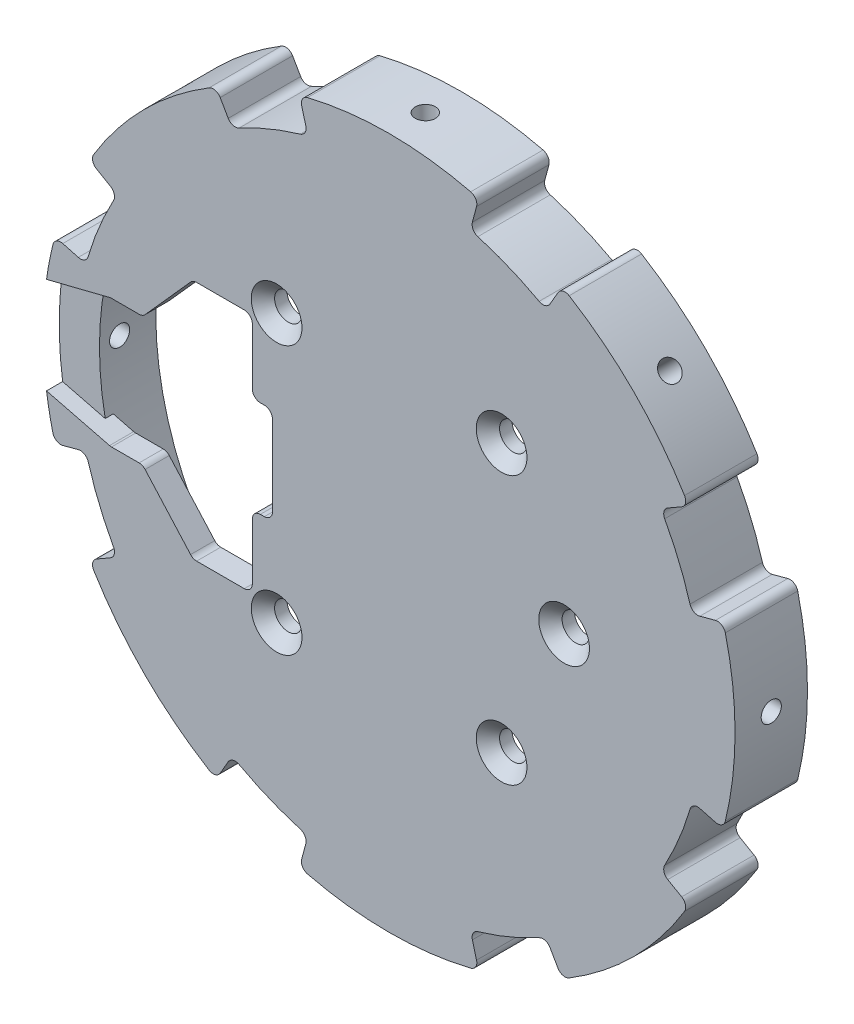
from build123d import *

# Parameters (mm, degrees)
SKETCH_1_R                   = 38
EXTRUDE_1_DEPTH              = 6
EXTRUDE_START                = 3
EXTRUDE_2_DEPTH              = 3
HOLE_WIZARD_M3_1_D           = 3.4
HOLE_WIZARD_M3_1_CSINK_D     = 6.3
HOLE_WIZARD_M3_1_CSINK_ANGLE = 90
M3X0_5_1_D                   = 2.5
M3X0_5_1_ON_FACE_2_D         = 2.5
M3X0_5_1_ON_FACE_3_D         = 2.5
M3X0_5_1_ON_FACE_4_D         = 2.5
M3X0_5_1_ON_FACE_5_D         = 2.5
M3X0_5_1_ON_FACE_6_D         = 2.5
M3X0_5_1_ON_FACE_7_D         = 2.5
M3X0_5_1_ON_FACE_8_D         = 2.5
CUT_EXTRUDE_START            = 3
CUT_EXTRUDE_1_DEPTH          = 3
EXTRUDE_START_2              = 1
EXTRUDE_3_DEPTH              = 1
FILLET_1_R                   = 1
FILLET_2_R                   = 1


with BuildPart() as part:
    # 草图1 → 凸台-拉伸1 (new body)
    with BuildSketch(Plane.XY):
        with BuildLine():
            Line((21.5, 37.239092363), (19.5, 33.774990748))
            ThreePointArc((19.5, 33.774990748), (14.924653862, 36.031301768), (10.093942759, 37.671107225))
            Line((10.093942759, 37.671107225), (11.129218939, 41.53481053))
            ThreePointArc((11.129218939, 41.53481053), (5.612626265, 42.632129039), (0, 43))
            ThreePointArc((0, 43), (-5.612626265, 42.632129039), (-11.129218939, 41.53481053))
            Line((-11.129218939, 41.53481053), (-10.093942759, 37.671107225))
            ThreePointArc((-10.093942759, 37.671107225), (-14.924653862, 36.031301768), (-19.5, 33.774990748))
            Line((-19.5, 33.774990748), (-21.5, 37.239092363))
            ThreePointArc((-21.5, 37.239092363), (-26.176741447, 34.114193633), (-30.405591591, 30.405591591))
            ThreePointArc((-30.405591591, 30.405591591), (-34.114193633, 26.176741447), (-37.239092363, 21.5))
            Line((-37.239092363, 21.5), (-33.774990748, 19.5))
            ThreePointArc((-33.774990748, 19.5), (-36.031301768, 14.924653862), (-37.671107225, 10.093942759))
            Line((-37.671107225, 10.093942759), (-41.53481053, 11.129218939))
            ThreePointArc((-41.53481053, 11.129218939), (-42.632129039, 5.612626265), (-43, 0))
            ThreePointArc((-43, 0), (-42.632129039, -5.612626265), (-41.53481053, -11.129218939))
            Line((-41.53481053, -11.129218939), (-37.671107225, -10.093942759))
            ThreePointArc((-37.671107225, -10.093942759), (-36.031301768, -14.924653862), (-33.774990748, -19.5))
            Line((-33.774990748, -19.5), (-37.239092363, -21.5))
            ThreePointArc((-37.239092363, -21.5), (-34.114193633, -26.176741447), (-30.405591591, -30.405591591))
            ThreePointArc((-30.405591591, -30.405591591), (-26.176741447, -34.114193633), (-21.5, -37.239092363))
            Line((-21.5, -37.239092363), (-19.5, -33.774990748))
            ThreePointArc((-19.5, -33.774990748), (-14.924653862, -36.031301768), (-10.093942759, -37.671107225))
            Line((-10.093942759, -37.671107225), (-11.129218939, -41.53481053))
            ThreePointArc((-11.129218939, -41.53481053), (-5.612626265, -42.632129039), (0, -43))
            ThreePointArc((0, -43), (5.612626265, -42.632129039), (11.129218939, -41.53481053))
            Line((11.129218939, -41.53481053), (10.093942759, -37.671107225))
            ThreePointArc((10.093942759, -37.671107225), (14.924653862, -36.031301768), (19.5, -33.774990748))
            Line((19.5, -33.774990748), (21.5, -37.239092363))
            ThreePointArc((21.5, -37.239092363), (26.176741447, -34.114193633), (30.405591591, -30.405591591))
            ThreePointArc((30.405591591, -30.405591591), (34.114193633, -26.176741447), (37.239092363, -21.5))
            Line((37.239092363, -21.5), (33.774990748, -19.5))
            ThreePointArc((33.774990748, -19.5), (36.031301768, -14.924653862), (37.671107225, -10.093942759))
            Line((37.671107225, -10.093942759), (41.53481053, -11.129218939))
            ThreePointArc((41.53481053, -11.129218939), (42.632129039, -5.612626265), (43, 0))
            ThreePointArc((43, 0), (42.632129039, 5.612626265), (41.53481053, 11.129218939))
            Line((41.53481053, 11.129218939), (37.671107225, 10.093942759))
            ThreePointArc((37.671107225, 10.093942759), (36.031301768, 14.924653862), (33.774990748, 19.5))
            Line((33.774990748, 19.5), (37.239092363, 21.5))
            ThreePointArc((37.239092363, 21.5), (34.114193633, 26.176741447), (30.405591591, 30.405591591))
            ThreePointArc((30.405591591, 30.405591591), (26.176741447, 34.114193633), (21.5, 37.239092363))
        make_face()
        Circle(SKETCH_1_R, mode=Mode.SUBTRACT)
    extrude(amount=-EXTRUDE_1_DEPTH)

    # 草图2 → 凸台-拉伸2 (add)
    with BuildSketch(Plane.XY.offset(EXTRUDE_START)):
        with BuildLine():
            Line((-11.129218939, 41.53481053), (-10.093942759, 37.671107225))
            ThreePointArc((-10.093942759, 37.671107225), (-14.924653862, 36.031301768), (-19.5, 33.774990748))
            Line((-19.5, 33.774990748), (-21.5, 37.239092363))
            ThreePointArc((-21.5, 37.239092363), (-26.176741447, 34.114193633), (-30.405591591, 30.405591591))
            ThreePointArc((-30.405591591, 30.405591591), (-34.114193633, 26.176741447), (-37.239092363, 21.5))
            Line((-37.239092363, 21.5), (-33.774990748, 19.5))
            ThreePointArc((-33.774990748, 19.5), (-36.031301768, 14.924653862), (-37.671107225, 10.093942759))
            Line((-37.671107225, 10.093942759), (-41.53481053, 11.129218939))
            ThreePointArc((-41.53481053, 11.129218939), (-42.632129039, 5.612626265), (-43, 0))
            ThreePointArc((-43, 0), (-42.632129039, -5.612626265), (-41.53481053, -11.129218939))
            Line((-41.53481053, -11.129218939), (-37.671107225, -10.093942759))
            ThreePointArc((-37.671107225, -10.093942759), (-36.031301768, -14.924653862), (-33.774990748, -19.5))
            Line((-33.774990748, -19.5), (-37.239092363, -21.5))
            ThreePointArc((-37.239092363, -21.5), (-34.114193633, -26.176741447), (-30.405591591, -30.405591591))
            ThreePointArc((-30.405591591, -30.405591591), (-26.176741447, -34.114193633), (-21.5, -37.239092363))
            Line((-21.5, -37.239092363), (-19.5, -33.774990748))
            ThreePointArc((-19.5, -33.774990748), (-14.924653862, -36.031301768), (-10.093942759, -37.671107225))
            Line((-10.093942759, -37.671107225), (-11.129218939, -41.53481053))
            ThreePointArc((-11.129218939, -41.53481053), (-5.612626265, -42.632129039), (0, -43))
            ThreePointArc((0, -43), (5.612626265, -42.632129039), (11.129218939, -41.53481053))
            Line((11.129218939, -41.53481053), (10.093942759, -37.671107225))
            ThreePointArc((10.093942759, -37.671107225), (14.924653862, -36.031301768), (19.5, -33.774990748))
            Line((19.5, -33.774990748), (21.5, -37.239092363))
            ThreePointArc((21.5, -37.239092363), (26.176741447, -34.114193633), (30.405591591, -30.405591591))
            ThreePointArc((30.405591591, -30.405591591), (34.114193633, -26.176741447), (37.239092363, -21.5))
            Line((37.239092363, -21.5), (33.774990748, -19.5))
            ThreePointArc((33.774990748, -19.5), (36.031301768, -14.924653862), (37.671107225, -10.093942759))
            Line((37.671107225, -10.093942759), (41.53481053, -11.129218939))
            ThreePointArc((41.53481053, -11.129218939), (42.632129039, -5.612626265), (43, 0))
            ThreePointArc((43, 0), (42.632129039, 5.612626265), (41.53481053, 11.129218939))
            Line((41.53481053, 11.129218939), (37.671107225, 10.093942759))
            ThreePointArc((37.671107225, 10.093942759), (36.031301768, 14.924653862), (33.774990748, 19.5))
            Line((33.774990748, 19.5), (37.239092363, 21.5))
            ThreePointArc((37.239092363, 21.5), (34.114193633, 26.176741447), (30.405591591, 30.405591591))
            ThreePointArc((30.405591591, 30.405591591), (26.176741447, 34.114193633), (21.5, 37.239092363))
            Line((21.5, 37.239092363), (19.5, 33.774990748))
            ThreePointArc((19.5, 33.774990748), (14.924653862, 36.031301768), (10.093942759, 37.671107225))
            Line((10.093942759, 37.671107225), (11.129218939, 41.53481053))
            ThreePointArc((11.129218939, 41.53481053), (5.612626265, 42.632129039), (0, 43))
            ThreePointArc((0, 43), (-5.612626265, 42.632129039), (-11.129218939, 41.53481053))
        make_face()
    extrude(amount=-EXTRUDE_2_DEPTH)

    # M3 锥坑平头的锥孔1 (through all)
    with Locations(Plane(origin=(13.98063051, -16.66146664, 3), x_dir=(1, 0, 0), z_dir=(0, 0, 1))):
        with Locations((0, 0), (7.76936949, 16.66146664), (0, 33.32293328), (-27.96126102, 0), (-35.73063051, 16.66146664), (-27.96126102, 33.32293328)):
            CounterSinkHole(HOLE_WIZARD_M3_1_D / 2, HOLE_WIZARD_M3_1_CSINK_D / 2, counter_sink_angle=HOLE_WIZARD_M3_1_CSINK_ANGLE)

    # M3x0.5 螺纹孔1 (through all)
    with Locations(Plane(origin=(0, -43, -1.5), x_dir=(-1, 0, 0), z_dir=(0, -1, 0))):
        with Locations((0, 0)):
            Hole(M3X0_5_1_D / 2)

    # M3x0.5 螺纹孔1 on face 2 (through all)
    with Locations(Plane(origin=(30.405591591, -30.405591591, -1.5), x_dir=(-0.707106781187, -0.707106781187, 0), z_dir=(0.707106781187, -0.707106781187, 0))):
        with Locations((0, 0)):
            Hole(M3X0_5_1_ON_FACE_2_D / 2)

    # M3x0.5 螺纹孔1 on face 3 (through all)
    with Locations(Plane(origin=(30.405591592, 30.40559159, -1.5), x_dir=(0.707106781187, -0.707106781187, 0), z_dir=(0.707106781187, 0.707106781187, 0))):
        with Locations((0, 0)):
            Hole(M3X0_5_1_ON_FACE_3_D / 2)

    # M3x0.5 螺纹孔1 on face 4 (through all)
    with Locations(Plane(origin=(43, 0, -1.5), x_dir=(0, 0, 1), z_dir=(1, 0, 0))):
        with Locations((0, 0)):
            Hole(M3X0_5_1_ON_FACE_4_D / 2)

    # M3x0.5 螺纹孔1 on face 5 (through all)
    with Locations(Plane(origin=(-30.405591591, 30.405591591, -1.5), x_dir=(0.707106781187, 0.707106781187, 0), z_dir=(-0.707106781187, 0.707106781187, 0))):
        with Locations((0, 0)):
            Hole(M3X0_5_1_ON_FACE_5_D / 2)

    # M3x0.5 螺纹孔1 on face 6 (through all)
    with Locations(Plane(origin=(-30.40559159, -30.405591592, -1.5), x_dir=(-0.707106781187, 0.707106781187, 0), z_dir=(-0.707106781187, -0.707106781187, 0))):
        with Locations((0, 0)):
            Hole(M3X0_5_1_ON_FACE_6_D / 2)

    # M3x0.5 螺纹孔1 on face 7 (through all)
    with Locations(Plane(origin=(-43, 0, -1.5), x_dir=(0, 0, -1), z_dir=(-1, 0, 0))):
        with Locations((0, 0)):
            Hole(M3X0_5_1_ON_FACE_7_D / 2)

    # M3x0.5 螺纹孔1 on face 8 (through all)
    with Locations(Plane(origin=(0, 43, -1.5), x_dir=(0, 0, 1), z_dir=(0, 1, 0))):
        with Locations((0, 0)):
            Hole(M3X0_5_1_ON_FACE_8_D / 2)

    # 草图6 → 切除-拉伸1 (cut)
    with BuildSketch(Plane.XY.offset(CUT_EXTRUDE_START)):
        with BuildLine():
            Line((-14.5, -6), (-14.5, 6))
            Line((-14.5, 6), (-17, 6))
            Line((-17, 6), (-17, 15))
            Line((-17, 15), (-24.37462575, 15))
            Line((-24.37462575, 15), (-30.624630174, 8))
            Line((-30.624630174, 8), (-34.624630174, 8))
            Line((-34.624630174, 8), (-42.579337712, 6))
            ThreePointArc((-42.579337712, 6), (-43, 0), (-42.579337712, -6))
            Line((-42.579337712, -6), (-34.624630174, -8))
            Line((-34.624630174, -8), (-30.624630174, -8))
            Line((-30.624630174, -8), (-24.37462575, -15))
            Line((-24.37462575, -15), (-17, -15))
            Line((-17, -15), (-17, -6))
            Line((-17, -6), (-14.5, -6))
        make_face()
    extrude(amount=-CUT_EXTRUDE_1_DEPTH, mode=Mode.SUBTRACT)

    # 草图9 → 凸台-拉伸3 (add)
    with BuildSketch(Plane.XY.offset(EXTRUDE_START_2)):
        with BuildLine():
            Line((-42.579337712, 6), (-37.286177193, 7.330824671))
            ThreePointArc((-37.286177193, 7.330824671), (-38, 0), (-37.286177193, -7.330824671))
            Line((-37.286177193, -7.330824671), (-42.579337712, -6))
            ThreePointArc((-42.579337712, -6), (-43, 0), (-42.579337712, 6))
        make_face()
    extrude(amount=-EXTRUDE_3_DEPTH)

    # 圆角1
    fillet_1_edges = [part.edges().sort_by_distance(p)[0] for p in [
        (-21.5, 37.239092363, -1.5),
        (-37.671107225, 10.093942759, -1.5),
        (-37.239092363, 21.5, -1.5),
        (-33.774990748, 19.5, -1.5),
        (-41.53481053, 11.129218939, -1.5),
        (-37.239092363, -21.5, -1.5),
        (-33.774990748, -19.5, -1.5),
        (-37.671107225, -10.093942759, -1.5),
        (-41.53481053, -11.129218939, -1.5),
        (-21.5, -37.239092363, -1.5),
        (-19.5, -33.774990748, -1.5),
        (-11.129218939, -41.53481053, -1.5),
        (-10.093942759, -37.671107225, -1.5),
        (21.5, -37.239092363, -1.5),
        (11.129218939, -41.53481053, -1.5),
        (10.093942759, -37.671107225, -1.5),
        (19.5, -33.774990748, -1.5),
        (37.239092363, -21.5, -1.5),
        (33.774990748, -19.5, -1.5),
        (37.671107225, 10.093942759, -1.5),
        (37.671107225, -10.093942759, -1.5),
        (41.53481053, -11.129218939, -1.5),
        (41.53481053, 11.129218939, -1.5),
        (33.774990748, 19.5, -1.5),
        (37.239092363, 21.5, -1.5),
        (10.093942759, 37.671107225, -1.5),
        (21.5, 37.239092363, -1.5),
        (19.5, 33.774990748, -1.5),
        (11.129218939, 41.53481053, -1.5),
        (-10.093942759, 37.671107225, -1.5),
        (-11.129218939, 41.53481053, -1.5),
        (-19.5, 33.774990748, -1.5),
    ]]
    fillet(fillet_1_edges, radius=FILLET_1_R)

    # 圆角2
    fillet_2_edges = [part.edges().sort_by_distance(p)[0] for p in [
        (-24.37462575, -15, 1.5),
        (-34.624630174, -8, 1.5),
        (-30.624630174, -8, 1.5),
        (-17, -15, 1.5),
        (-14.5, -6, 1.5),
        (-17, 15, 1.5),
        (-30.624630174, 8, 1.5),
        (-17, -6, 1.5),
        (-14.5, 6, 1.5),
        (-17, 6, 1.5),
        (-24.37462575, 15, 1.5),
        (-34.624630174, 8, 1.5),
    ]]
    fillet(fillet_2_edges, radius=FILLET_2_R)


solid = part.part
